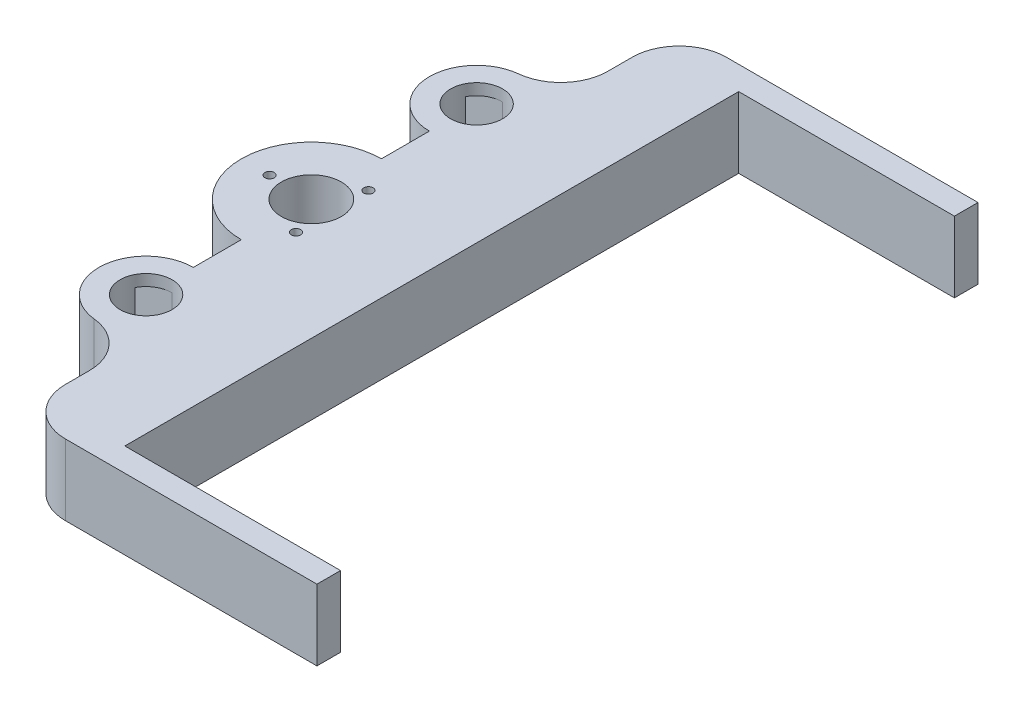
from build123d import *

# Parameters (mm, degrees)
SKETCH1_W             = 79.209653246
SKETCH1_H             = 177.8
SKETCH1_R             = 8.0645
SKETCH1_R_2           = 6.985
EXTRUSION4_DEPTH      = 19.05
EXTRUSION5_REACH      = 101.17
SKETCH2_R             = 1.25
EXTRUSION10_REACH     = 101.17
SKETCH3_W             = 19.919826623
SKETCH3_H             = 165.1
SKETCH4_W             = 6.35
SKETCH4_H             = 19.05
EXTRUSION11_DEPTH     = 50.8
SKETCH5_W             = 165.1
SKETCH5_H             = 19.05
EXTRUSION12_DEPTH     = 12.7
EXTRUSION14_REACH     = 130.215
EXTRUSION15_OUTLINE_W = 3.81
EXTRUSION15_OUTLINE_H = 12.954
EXTRUSION15_DEPTH     = 12.296722124
FILLET8_R             = 12.7


# Read off the part's stored shape, not the designer's step: Extrusion15
with BuildPart() as part:
    # Sketch1 → Extrusion4 (new body)
    with BuildSketch(Plane(origin=(0, 0, 0), x_dir=(-1, 0, 0), z_dir=(0, 1, 0))):
        Rectangle(SKETCH1_W, SKETCH1_H)
        with Locations(Location((0, 0, 0), (0, 0, 270))):
            Circle(SKETCH1_R, mode=Mode.SUBTRACT)
        with Locations(Location((0, 44.45, 0), (0, 0, 270))):
            Circle(SKETCH1_R_2, mode=Mode.SUBTRACT)
        with Locations(Location((0, -44.45, 0), (0, 0, 270))):
            Circle(SKETCH1_R_2, mode=Mode.SUBTRACT)
    extrude(amount=EXTRUSION4_DEPTH)

    # Sketch2 → Extrusion5 (cut, up to next)
    with BuildSketch(Plane(origin=(0, 19.05, 0), x_dir=(1, 0, 0), z_dir=(0, 1, 0)), mode=Mode.PRIVATE) as extrusion5_sk1:
        with Locations(Location((-11.2395, 0, 0), (0, 0, 270))):
            Circle(SKETCH2_R)
    extrusion5_tool1 = extrude(extrusion5_sk1.sketch, amount=-EXTRUSION5_REACH, mode=Mode.PRIVATE) & part.part
    # Sketch2 → Extrusion5 (cut, up to next)
    with BuildSketch(Plane(origin=(0, 19.05, 0), x_dir=(1, 0, 0), z_dir=(0, 1, 0)), mode=Mode.PRIVATE) as extrusion5_sk2:
        with Locations(Location((5.61975, -9.733692526, 0), (0, 0, 270))):
            Circle(SKETCH2_R)
    extrusion5_tool2 = extrude(extrusion5_sk2.sketch, amount=-EXTRUSION5_REACH, mode=Mode.PRIVATE) & part.part
    # Sketch2 → Extrusion5 (cut, up to next)
    with BuildSketch(Plane(origin=(0, 19.05, 0), x_dir=(1, 0, 0), z_dir=(0, 1, 0)), mode=Mode.PRIVATE) as extrusion5_sk3:
        with Locations(Location((5.61975, 9.733692526, 0), (0, 0, 270))):
            Circle(SKETCH2_R)
    extrusion5_tool3 = extrude(extrusion5_sk3.sketch, amount=-EXTRUSION5_REACH, mode=Mode.PRIVATE) & part.part
    add(extrusion5_tool1.solids().sort_by_distance((-11.2395, 19.05, 0))[0], mode=Mode.SUBTRACT)
    add(extrusion5_tool2.solids().sort_by_distance((5.61975, 19.05, 9.733693))[0], mode=Mode.SUBTRACT)
    add(extrusion5_tool3.solids().sort_by_distance((5.61975, 19.05, -9.733693))[0], mode=Mode.SUBTRACT)

    # Sketch3 → Extrusion10 (cut, up to next)
    with BuildSketch(Plane(origin=(0, 19.05, 0), x_dir=(1, 0, 0), z_dir=(0, 1, 0)), mode=Mode.PRIVATE) as extrusion10_sk1:
        with Locations((29.644913312, 0)):
            Rectangle(SKETCH3_W, SKETCH3_H)
    extrusion10_tool1 = extrude(extrusion10_sk1.sketch, amount=-EXTRUSION10_REACH, mode=Mode.PRIVATE) & part.part
    add(extrusion10_tool1.solids().sort_by_distance((29.644913, 19.05, 0))[0], mode=Mode.SUBTRACT)

    # Sketch4 → Extrusion11 (add)
    with BuildSketch(Plane(origin=(39.604826623, 0, 0), x_dir=(0, 0, -1), z_dir=(1, 0, 0))):
        with Locations((-85.725, 9.525)):
            Rectangle(SKETCH4_W, SKETCH4_H)
        with Locations((85.725, 9.525)):
            Rectangle(SKETCH4_W, SKETCH4_H)
    extrude(amount=EXTRUSION11_DEPTH)

    # Sketch5 → Extrusion12 (add)
    with BuildSketch(Plane(origin=(19.685, 0, 0), x_dir=(0, 0, -1), z_dir=(1, 0, 0))):
        with Locations((0, 9.525)):
            Rectangle(SKETCH5_W, SKETCH5_H)
    extrude(amount=EXTRUSION12_DEPTH)

    # Sketch6 → Extrusion14 (cut, up to next)
    with BuildSketch(Plane(origin=(0, 19.05, 0), x_dir=(1, 0, 0), z_dir=(0, 1, 0)), mode=Mode.PRIVATE) as extrusion14_sk1:
        with BuildLine():
            Line((0, 18.8395), (0, 31.75))
            ThreePointArc((0, 31.75), (-12.7, 44.45), (0, 57.15))
            Line((0, 57.15), (10.060139055, 57.15))
            Line((10.060139055, 57.15), (10.060139055, 88.9))
            Line((10.060139055, 88.9), (-39.604826623, 88.9))
            Line((-39.604826623, 88.9), (-39.604826623, -88.9))
            Line((-39.604826623, -88.9), (10.060139055, -88.9))
            Line((10.060139055, -88.9), (10.060139055, -57.15))
            Line((10.060139055, -57.15), (0, -57.15))
            ThreePointArc((0, -57.15), (-12.7, -44.45), (0, -31.75))
            Line((0, -31.75), (0, -18.8395))
            ThreePointArc((0, -18.8395), (-18.8395, 0), (0, 18.8395))
        make_face()
    extrusion14_tool1 = extrude(extrusion14_sk1.sketch, amount=-EXTRUSION14_REACH, mode=Mode.PRIVATE) & part.part
    add(extrusion14_tool1.solids().sort_by_distance((-19.50343, 19.05, 0))[0], mode=Mode.SUBTRACT)

    # Extrusion15 outline → Extrusion15 (cut)
    with BuildSketch(Plane.ZY):
        with Locations((-39.37, 9.525)):
            Rectangle(EXTRUSION15_OUTLINE_W, EXTRUSION15_OUTLINE_H)
        with Locations((-49.53, 9.525)):
            Rectangle(EXTRUSION15_OUTLINE_W, EXTRUSION15_OUTLINE_H)
    extrusion15 = extrude(amount=EXTRUSION15_DEPTH, mode=Mode.SUBTRACT)

    # Mirror3: Extrusion15 across plane
    add(extrusion15.mirror(Plane.XY), mode=Mode.SUBTRACT)

    # Fillet8
    fillet8_edges = [part.edges().sort_by_distance(p)[0] for p in [
        (10.060139055, 9.525, -57.15),
        (10.060139055, 9.525, -88.9),
        (10.060139055, 9.525, 88.9),
        (10.060139055, 9.525, 57.15),
    ]]
    fillet(fillet8_edges, radius=FILLET8_R)


solid = part.part
